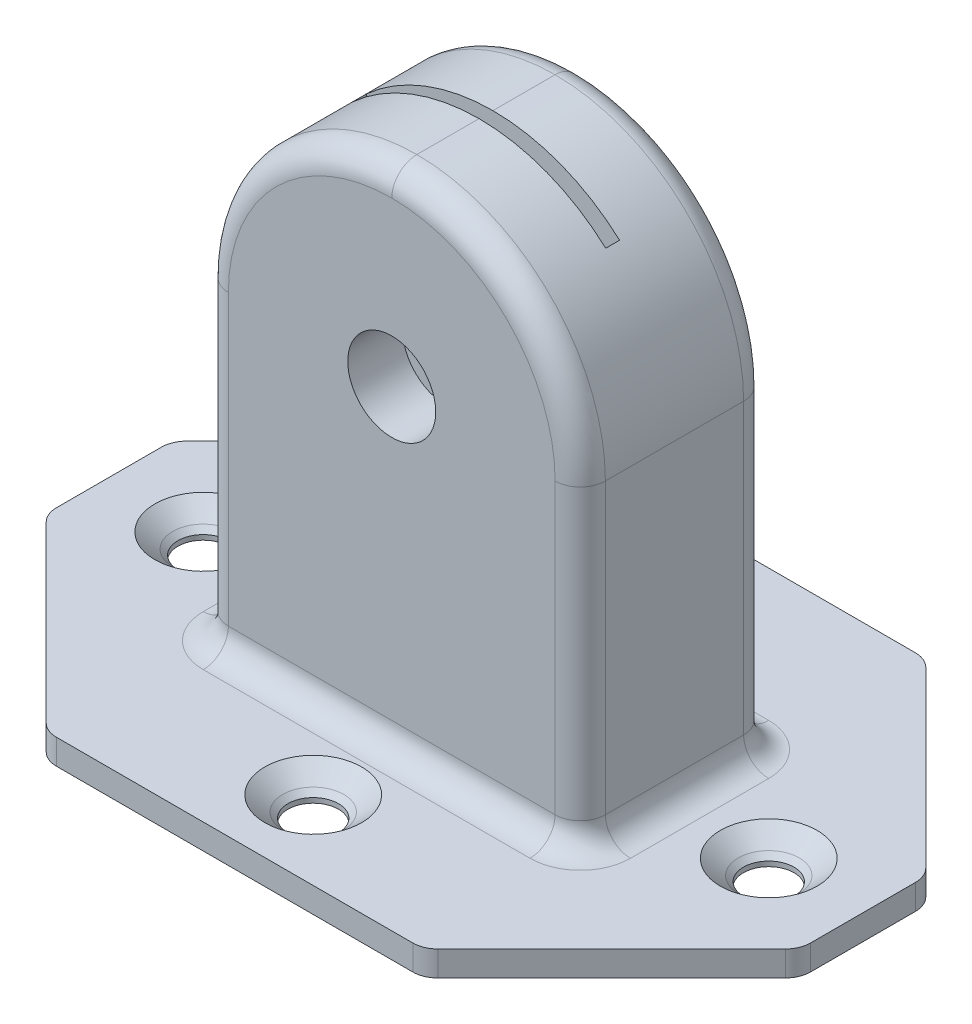
from build123d import *

# Parameters (mm, degrees)
MAIN_BASE_DIM_W                            = 76.2
MAIN_BASE_DIM_H                            = 50.8
MAIN_BASE_DEPTH                            = 2.54
LINKAGE_HOLDER_DIM_W                       = 38.1
LINKAGE_HOLDER_DIM_H                       = 19.05
LINKAGE_HOLDER_DEPTH                       = 50.8
LINKAGE_SLOT_DIM_W                         = 25.6
LINKAGE_SLOT_DIM_H                         = 1.4
LINKAGE_SLOT_DEPTH                         = 50.8
F_75IN_FILLET_R                            = 19.05
BOLT_HOLE_REACH                            = 101.355
BOLT_HOLE_DIM_R                            = 2.1828
BOLT_HEAD_DIM_R                            = 4.445
BOLT_HEAD_DEPTH                            = 5.5372
NUT_SLOT_DEPTH                             = 5.5372
CSK_FOR_10_FLAT_HEAD_MACHINE_SCREW_2_COUNT = 2
CSK_FOR_10_FLAT_HEAD_MACHINE_SCREW_2_PITCH = 33.488349187
CSK_FOR_10_FLAT_HEAD_MACHINE_SCREW_3_COUNT = 2
CSK_FOR_10_FLAT_HEAD_MACHINE_SCREW_3_PITCH = 57.15
CSK_FOR_10_FLAT_HEAD_MACHINE_SCREW_4_COUNT = 2
CSK_FOR_10_FLAT_HEAD_MACHINE_SCREW_4_PITCH = 33.488349187
CORNER_CUT_DEPTH                           = 2.54
F_1IN_FILLET_R                             = 2.54


with BuildPart() as part:
    # Main_Base_Dim → Main_Base (new body)
    with BuildSketch(Plane(origin=(0, 0, 0), x_dir=(1, 0, 0), z_dir=(0, 1, 0))):
        with Locations((38.1, 25.4)):
            Rectangle(MAIN_BASE_DIM_W, MAIN_BASE_DIM_H)
    extrude(amount=MAIN_BASE_DEPTH)

    # Linkage_Holder_Dim → Linkage_Holder (add)
    with BuildSketch(Plane(origin=(0, 2.54, 0), x_dir=(1, 0, 0), z_dir=(0, 1, 0))):
        with Locations((38.1, 25.4)):
            Rectangle(LINKAGE_HOLDER_DIM_W, LINKAGE_HOLDER_DIM_H)
    extrude(amount=LINKAGE_HOLDER_DEPTH)

    # Linkage_Slot_Dim → Linkage_Slot (cut)
    with BuildSketch(Plane(origin=(0, 53.34, 0), x_dir=(1, 0, 0), z_dir=(0, 1, 0))):
        with Locations((38.1, 25.4)):
            Rectangle(LINKAGE_SLOT_DIM_W, LINKAGE_SLOT_DIM_H)
    extrude(amount=-LINKAGE_SLOT_DEPTH, mode=Mode.SUBTRACT)

    # .75in_Fillet
    # the kernel refuses this fillet: 19.05 mm, written as the material it takes off along each edge
    with BuildSketch(Plane(origin=(57.15, 53.34, -82.55), x_dir=(0, -1, 0), z_dir=(0, 0, 1)), Plane(origin=(19.05, 53.34, 31.75), x_dir=(0, -1, 0), z_dir=(0, 0, -1))) as f_75in_fillet_piece_1:
        with BuildLine():
            CenterArc((F_75IN_FILLET_R, -F_75IN_FILLET_R), F_75IN_FILLET_R, 90, 90)
            Line((0, -F_75IN_FILLET_R), (0, 0))
            Line((0, 0), (F_75IN_FILLET_R, 0))
        make_face()
    extrude(amount=114.3, mode=Mode.SUBTRACT)

    # Bolt_Hole: up to this face of the body (flat: up to its plane)
    bolt_hole_end = Plane(part.part.faces().sort_by_distance((38.1, 26.089428348, -34.925))[0])
    # Bolt_Hole_Dim → Bolt_Hole (cut, up to the picked face)
    with BuildSketch(Plane.XY.offset(-15.875), mode=Mode.PRIVATE) as bolt_hole_sk1:
        with Locations((38.1, 34.29)):
            Circle(BOLT_HOLE_DIM_R)
    bolt_hole_tool1 = split(extrude(bolt_hole_sk1.sketch, amount=-BOLT_HOLE_REACH, mode=Mode.PRIVATE), bisect_by=bolt_hole_end, keep=Keep.BOTH, mode=Mode.PRIVATE)
    add(bolt_hole_tool1.solids().sort_by(Axis((38.1, 34.29, -15.875), (0, 0, -1)))[0], mode=Mode.SUBTRACT)

    # Bolt_Head_Dim → Bolt_Head (cut)
    with BuildSketch(Plane.XY.offset(-15.875)):
        with Locations((38.1, 34.29)):
            Circle(BOLT_HEAD_DIM_R)
    extrude(amount=-BOLT_HEAD_DEPTH, mode=Mode.SUBTRACT)

    # Nut_Slot_Dim → Nut_Slot (cut)
    with BuildSketch(Plane(origin=(0, 0, -34.925), x_dir=(-1, 0, 0), z_dir=(0, 0, -1))):
        Polygon((-35.6235, 38.579423825), (-40.5765, 38.579423825), (-43.053, 34.29), (-40.5765, 30.000576175), (-35.6235, 30.000576175), (-33.147, 34.29), align=None)
    extrude(amount=-NUT_SLOT_DEPTH, mode=Mode.SUBTRACT)

    # Sketch9 → CSK for #10 Flat Head Machine Screw (100)1 (revolve, cut)
    with BuildSketch(Plane(origin=(9.525, 2.54, -25.4), x_dir=(0, 0, 1), z_dir=(1, 0, 0))):
        Polygon((0, 0), (0, 2.54), (2.5527, 2.54), (2.5527, 1.960808018), (4.8895, 0), align=None)
    csk_for_10_flat_head_machine_screw_100 = revolve(axis=Axis((9.525, 8.89, -25.4), (0, -1, 0)), mode=Mode.SUBTRACT)

    # CSK for _10 Flat Head Machine Screw  2: CSK for #10 Flat Head Machine Screw (100)1 ×2
    with Locations(*[Vector(0.8532818336519591, 0, -0.5214500094539748) * (i * CSK_FOR_10_FLAT_HEAD_MACHINE_SCREW_2_PITCH) for i in range(1, CSK_FOR_10_FLAT_HEAD_MACHINE_SCREW_2_COUNT)]):
        add(csk_for_10_flat_head_machine_screw_100, mode=Mode.SUBTRACT)

    # CSK for _10 Flat Head Machine Screw  3: CSK for #10 Flat Head Machine Screw (100)1 ×2
    with Locations(*[(i * CSK_FOR_10_FLAT_HEAD_MACHINE_SCREW_3_PITCH, 0, 0) for i in range(1, CSK_FOR_10_FLAT_HEAD_MACHINE_SCREW_3_COUNT)]):
        add(csk_for_10_flat_head_machine_screw_100, mode=Mode.SUBTRACT)

    # CSK for _10 Flat Head Machine Screw  4: CSK for #10 Flat Head Machine Screw (100)1 ×2
    with Locations(*[Vector(0.853281833651959, 0, 0.521450009453975) * (i * CSK_FOR_10_FLAT_HEAD_MACHINE_SCREW_4_PITCH) for i in range(1, CSK_FOR_10_FLAT_HEAD_MACHINE_SCREW_4_COUNT)]):
        add(csk_for_10_flat_head_machine_screw_100, mode=Mode.SUBTRACT)

    # Screw_Hole cone 1 section (through the dimple's axis) → Screw_Hole (revolve, cut)
    with BuildSketch(Plane(origin=(9.525, 2.54, -25.4), x_dir=(0, 0, 1), z_dir=(1, 0, 0))):
        Polygon((0, 0), (4.6, 0), (0, 4.6), align=None)
    revolve(axis=Axis((9.525, 2.54, -25.4), (0, -1, 0)), mode=Mode.SUBTRACT)

    # Screw_Hole cone 2 section (through the dimple's axis) → Screw_Hole cone 2 (revolve, cut)
    with BuildSketch(Plane(origin=(38.1, 2.54, -42.8625), x_dir=(0, 0, 1), z_dir=(1, 0, 0))):
        Polygon((0, 0), (4.6, 0), (0, 4.6), align=None)
    revolve(axis=Axis((38.1, 2.54, -42.8625), (0, -1, 0)), mode=Mode.SUBTRACT)

    # Screw_Hole cone 3 section (through the dimple's axis) → Screw_Hole cone 3 (revolve, cut)
    with BuildSketch(Plane(origin=(66.675, 2.54, -25.4), x_dir=(0, 0, 1), z_dir=(1, 0, 0))):
        Polygon((0, 0), (4.6, 0), (0, 4.6), align=None)
    revolve(axis=Axis((66.675, 2.54, -25.4), (0, -1, 0)), mode=Mode.SUBTRACT)

    # Screw_Hole cone 4 section (through the dimple's axis) → Screw_Hole cone 4 (revolve, cut)
    with BuildSketch(Plane(origin=(38.1, 2.54, -7.9375), x_dir=(0, 0, 1), z_dir=(1, 0, 0))):
        Polygon((0, 0), (4.6, 0), (0, 4.6), align=None)
    revolve(axis=Axis((38.1, 2.54, -7.9375), (0, -1, 0)), mode=Mode.SUBTRACT)

    # Corner_Cut_Dim → Corner_Cut (cut)
    with BuildSketch(Plane(origin=(0, 2.54, 0), x_dir=(1, 0, 0), z_dir=(0, 1, 0))):
        Polygon((0, 0), (0, 19.05), (19.05, 0), align=None)
        Polygon((76.2, 0), (76.2, 19.05), (57.15, 0), align=None)
        Polygon((76.2, 50.8), (76.2, 31.75), (57.15, 50.8), align=None)
        Polygon((0, 31.75), (19.05, 50.8), (0, 50.8), align=None)
    extrude(amount=-CORNER_CUT_DEPTH, mode=Mode.SUBTRACT)

    # .1in_Fillet
    f_1in_fillet_edges = [part.edges().sort_by_distance(p)[0] for p in [
        (19.05, 2.54, -25.4),
        (19.05, 1.27, -50.8),
        (0, 1.27, -31.75),
        (38.1, 2.54, -15.875),
        (76.2, 1.27, -31.75),
        (57.15, 1.27, -50.8),
        (57.15, 2.54, -25.4),
        (76.2, 1.27, -19.05),
        (57.15, 1.27, 0),
        (38.1, 2.54, -34.925),
        (0, 1.27, -19.05),
        (19.05, 1.27, 0),
        (19.05, 18.415, -34.925),
        (57.15, 18.415, -34.925),
        (38.1, 53.34, -34.925),
        (38.1, 53.34, -34.925),
        (57.15, 18.415, -15.875),
        (19.05, 18.415, -15.875),
        (38.1, 53.34, -15.875),
        (38.1, 53.34, -15.875),
    ]]
    fillet(f_1in_fillet_edges, radius=F_1IN_FILLET_R)


solid = part.part
